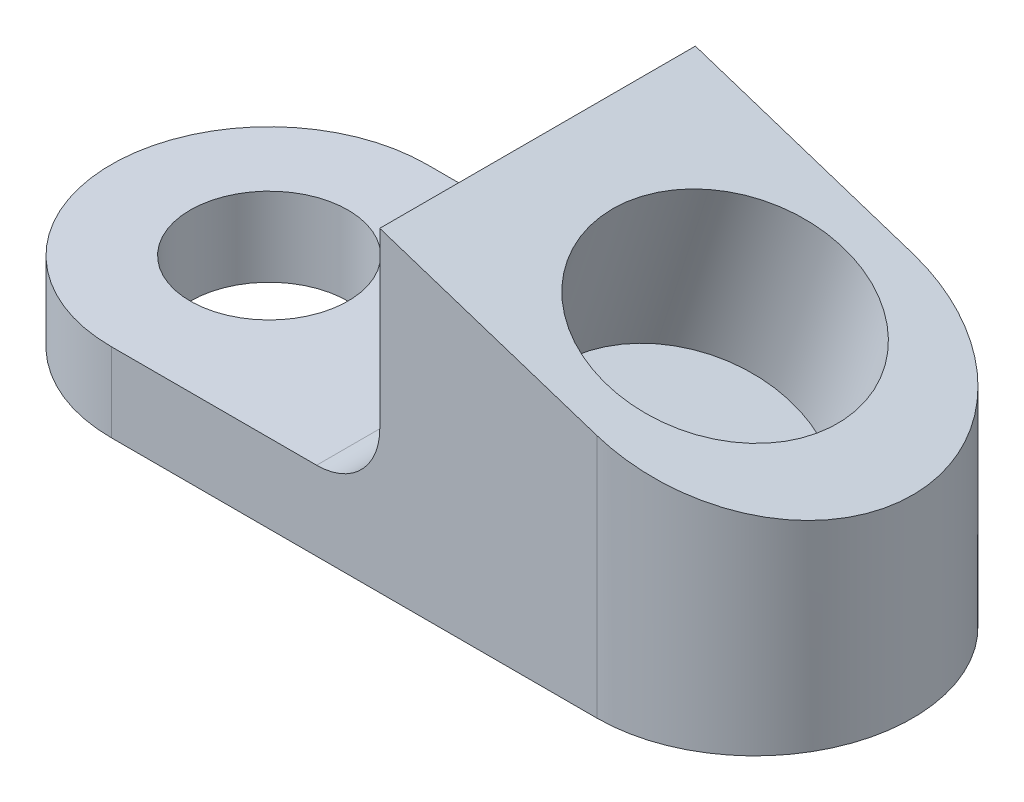
from build123d import *

# Parameters (mm, degrees)
BOSS_EXTRUDE1_DEPTH = 12.7
CUT_EXTRUDE1_START  = -13.521664
SKETCH2_R           = 9.525
CUT_EXTRUDE1_DEPTH  = 13.521664
SKETCH3_R           = 6.35
CUT_EXTRUDE2_DEPTH  = 77.878671194
FILLET3_START       = -1
FILLET3_DEPTH       = 26.4
CUT_EXTRUDE3_DEPTH  = 77.878671193
FILLET4_R           = 5.08


with BuildPart() as part:
    # Sketch1 → Boss-Extrude1 (new, symmetric)
    with BuildSketch(Plane.XY):
        Polygon((0, 0), (73.390309881, 0), (73.390309881, 15.548608999), (43.207324686, 25.4), (43.207324686, 6.35), (0, 6.35), align=None)
    extrude(amount=BOSS_EXTRUDE1_DEPTH, both=True)

    # Sketch2 → Cut-Extrude1 (cut)
    with BuildSketch(Plane(origin=(11.651871006, 35.699349465, 0), x_dir=(0.9506452030208671, -0.3102800315415328, 0), z_dir=(0.3102800315415327, 0.950645203020867, 0)).offset(CUT_EXTRUDE1_START)):
        with Locations(Location((49.068723147, 0, 0), (0, 0, 180))):
            Circle(SKETCH2_R)
    extrude(amount=CUT_EXTRUDE1_DEPTH, mode=Mode.SUBTRACT)

    # Sketch3 → Cut-Extrude2 (cut, through all)
    with BuildSketch(Plane(origin=(0, 6.35, 0), x_dir=(1, 0, 0), z_dir=(0, 1, 0))):
        with Locations(Location((21.603662343, 0, 0), (0, 0, 180))):
            Circle(SKETCH3_R)
    extrude(amount=-CUT_EXTRUDE2_DEPTH, mode=Mode.SUBTRACT)

    # Fillet3: read off the stored shape, not the designer's step
    # Fillet3 outline → Fillet3 (cut)
    with BuildSketch(Plane(origin=(0, 0, 0), x_dir=(1, 0, 0), z_dir=(0, 1, 0)).offset(FILLET3_START)):
        with BuildLine():
            ThreePointArc((60.690309881, 12.7), (69.670566002, 8.980256121), (73.390309881, 0))
            Line((73.390309881, 0), (73.390309881, 12.7))
            Line((73.390309881, 12.7), (60.690309881, 12.7))
        make_face()
        with BuildLine():
            ThreePointArc((73.390309881, 0), (69.670566002, -8.980256121), (60.690309881, -12.7))
            Line((60.690309881, -12.7), (73.390309881, -12.7))
            Line((73.390309881, -12.7), (73.390309881, 0))
        make_face()
    extrude(amount=FILLET3_DEPTH, mode=Mode.SUBTRACT)

    # Sketch4 → Cut-Extrude3 (cut, through all)
    with BuildSketch(Plane(origin=(0, 6.35, 0), x_dir=(1, 0, 0), z_dir=(0, 1, 0))):
        with BuildLine():
            Line((21.603662343, 12.7), (0, 12.7))
            Line((0, 12.7), (0, -12.7))
            Line((0, -12.7), (21.603662343, -12.7))
            ThreePointArc((21.603662343, -12.7), (8.903662343, 0), (21.603662343, 12.7))
        make_face()
    extrude(amount=-CUT_EXTRUDE3_DEPTH, mode=Mode.SUBTRACT)

    # Fillet4
    fillet4_edges = [part.edges().sort_by_distance(p)[0] for p in [
        (43.207324686, 6.35, 0),
    ]]
    fillet(fillet4_edges, radius=FILLET4_R)


solid = part.part
